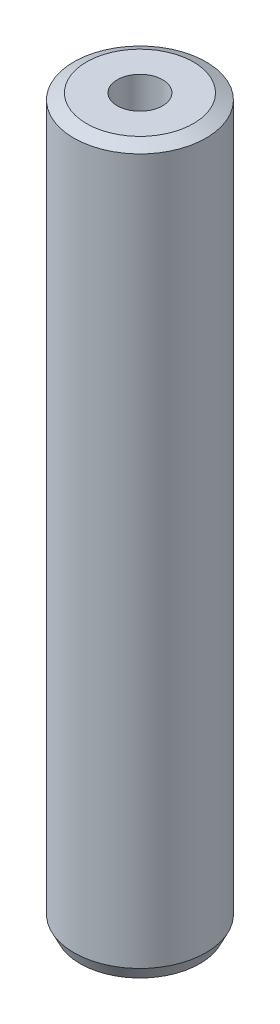
from build123d import *
from OCP.BRepFilletAPI import BRepFilletAPI_MakeChamfer

# Parameters (mm, degrees)
SKETCH1_R           = 30
BOSS_EXTRUDE1_DEPTH = 328.687320321
SKETCH2_R           = 10.274076516
CUT_EXTRUDE1_DEPTH  = 332.414173716
CHAMFER1_SIZE       = 2.831597497
CHAMFER1_SIZE2      = 5.752702221


with BuildPart() as part:
    # Sketch1 → Boss-Extrude1 (new body)
    with BuildSketch(Plane(origin=(0, 0, 0), x_dir=(1, 0, 0), z_dir=(0, 1, 0))):
        Circle(SKETCH1_R)
    extrude(amount=BOSS_EXTRUDE1_DEPTH)

    # Sketch2 → Cut-Extrude1 (cut, through all)
    with BuildSketch(Plane(origin=(0, 0, 0), x_dir=(1, 0, 0), z_dir=(0, 1, 0))):
        Circle(SKETCH2_R)
    extrude(amount=CUT_EXTRUDE1_DEPTH, mode=Mode.SUBTRACT)

    # Chamfer1: one chamfer whose edges measure the first distance from different faces: ONE call of the kernel's chamfer builder (chamfer() names one face for all edges)
    chamfer1_edges_1 = [part.edges().sort_by_distance(p)[0] for p in [
        (-30, 328.687320321, 0),
    ]]
    chamfer1_side_1 = [part.faces().sort_by_distance(p)[0] for p in [
        (-30, 164.343660161, 0),
    ]]
    chamfer1_edges_2 = [part.edges().sort_by_distance(p)[0] for p in [
        (-30, 0, 0),
    ]]
    chamfer1_side_2 = [part.faces().sort_by_distance(p)[0] for p in [
        (-29.151471863, 0, 0),
    ]]
    chamfer1 = BRepFilletAPI_MakeChamfer(part.part.solid().wrapped)
    for e in chamfer1_edges_1:
        chamfer1.Add(CHAMFER1_SIZE, CHAMFER1_SIZE2, e.wrapped, chamfer1_side_1[0].wrapped)  # the first distance lies on this face
    for e in chamfer1_edges_2:
        chamfer1.Add(CHAMFER1_SIZE, CHAMFER1_SIZE2, e.wrapped, chamfer1_side_2[0].wrapped)  # the first distance lies on this face
    add(Compound.cast(chamfer1.Shape()), mode=Mode.REPLACE)


solid = part.part
